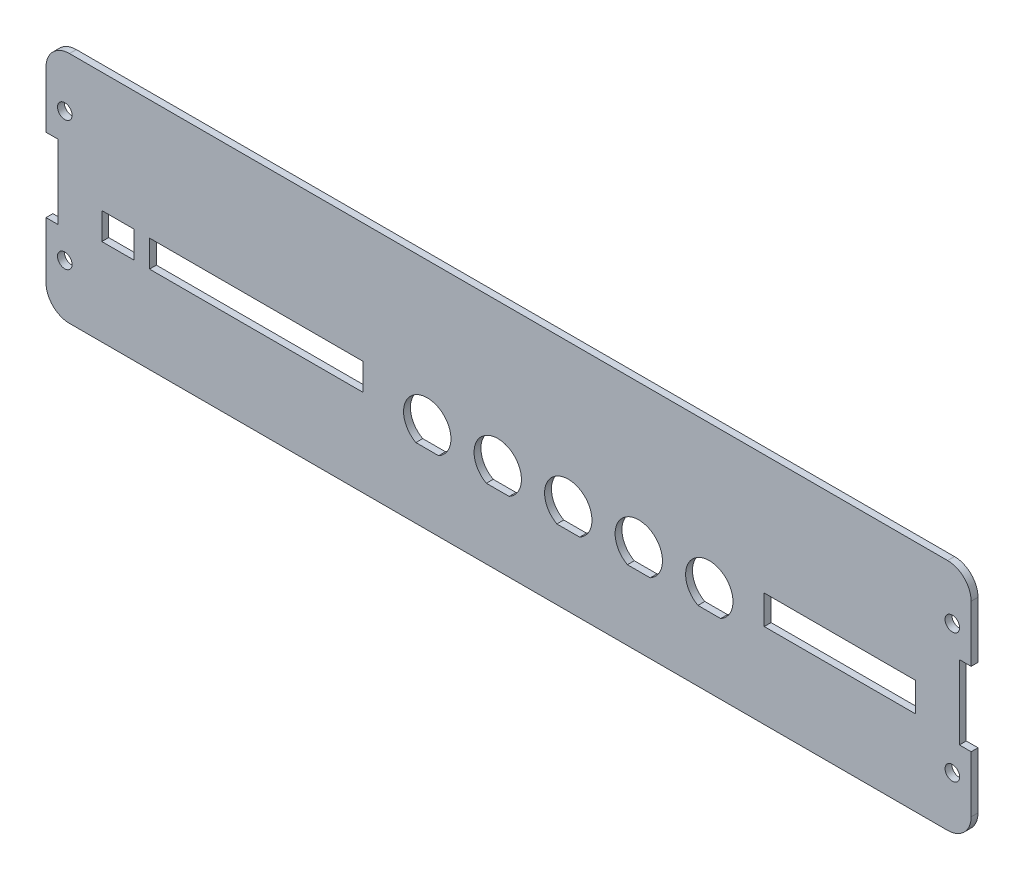
from build123d import *

# Parameters (mm, degrees)
MAINBODY_DEPTH     = 1.8542
SKETCH3_R          = 1.9685
MOUNTHOLES_DEPTH   = 129.907885308
CUT_EXTRUDE1_REACH = 130.908
SKETCH4_W          = 40.934
SKETCH4_H          = 7.854
SKETCH4_W_2        = 57.654
SKETCH4_H_2        = 7.254
SKETCH4_W_3        = 8.654


with BuildPart() as part:
    # Sketch2 → MainBody (new body)
    with BuildSketch(Plane.XY):
        with BuildLine():
            Line((118.618, 31.5722), (-118.618, 31.5722))
            ThreePointArc((-118.618, 31.5722), (-123.108128061, 29.712328061), (-124.968, 25.2222))
            Line((-124.968, 25.2222), (-124.968, 9.9822))
            Line((-124.968, 9.9822), (-121.793, 9.9822))
            Line((-121.793, 9.9822), (-121.793, -9.9822))
            Line((-121.793, -9.9822), (-124.968, -9.9822))
            Line((-124.968, -9.9822), (-124.968, -25.2222))
            ThreePointArc((-124.968, -25.2222), (-123.108128061, -29.712328061), (-118.618, -31.5722))
            Line((-118.618, -31.5722), (118.618, -31.5722))
            ThreePointArc((118.618, -31.5722), (123.108128061, -29.712328061), (124.968, -25.2222))
            Line((124.968, -25.2222), (124.968, -9.9822))
            Line((124.968, -9.9822), (121.793, -9.9822))
            Line((121.793, -9.9822), (121.793, 9.9822))
            Line((121.793, 9.9822), (124.968, 9.9822))
            Line((124.968, 9.9822), (124.968, 25.2222))
            ThreePointArc((124.968, 25.2222), (123.108128061, 29.712328061), (118.618, 31.5722))
        make_face()
    extrude(amount=MAINBODY_DEPTH)

    # Sketch3 → MountHoles (cut, through all)
    with BuildSketch(Plane.XY.offset(1.8542)):
        with Locations((-119.888, 17.4625)):
            Circle(SKETCH3_R)
        with Locations((119.888, 17.4625)):
            Circle(SKETCH3_R)
        with Locations((119.888, -17.4625)):
            Circle(SKETCH3_R)
        with Locations((-119.888, -17.4625)):
            Circle(SKETCH3_R)
    extrude(amount=-MOUNTHOLES_DEPTH, mode=Mode.SUBTRACT)

    # Sketch4 → Cut-Extrude1 (cut, up to next)
    with BuildSketch(Plane.XY.offset(1.8542), mode=Mode.PRIVATE) as cut_extrude1_sk1:
        with BuildLine():
            Line((51.153291776, -12.65754977), (57.304708224, -12.65754977))
            ThreePointArc((57.304708224, -12.65754977), (54.229, -0.64334977), (51.153291776, -12.65754977))
        make_face()
    cut_extrude1_tool1 = extrude(cut_extrude1_sk1.sketch, amount=-CUT_EXTRUDE1_REACH, mode=Mode.PRIVATE) & part.part
    # Sketch4 → Cut-Extrude1 (cut, up to next)
    with BuildSketch(Plane.XY.offset(1.8542), mode=Mode.PRIVATE) as cut_extrude1_sk2:
        with Locations((89.535, -4.72055)):
            Rectangle(SKETCH4_W, SKETCH4_H)
    cut_extrude1_tool2 = extrude(cut_extrude1_sk2.sketch, amount=-CUT_EXTRUDE1_REACH, mode=Mode.PRIVATE) & part.part
    # Sketch4 → Cut-Extrude1 (cut, up to next)
    with BuildSketch(Plane.XY.offset(1.8542), mode=Mode.PRIVATE) as cut_extrude1_sk3:
        with BuildLine():
            Line((32.103291776, -12.65754977), (38.254708224, -12.65754977))
            ThreePointArc((38.254708224, -12.65754977), (35.179, -0.64334977), (32.103291776, -12.65754977))
        make_face()
    cut_extrude1_tool3 = extrude(cut_extrude1_sk3.sketch, amount=-CUT_EXTRUDE1_REACH, mode=Mode.PRIVATE) & part.part
    # Sketch4 → Cut-Extrude1 (cut, up to next)
    with BuildSketch(Plane.XY.offset(1.8542), mode=Mode.PRIVATE) as cut_extrude1_sk4:
        with BuildLine():
            Line((13.053291776, -12.65754977), (19.204708224, -12.65754977))
            ThreePointArc((19.204708224, -12.65754977), (16.129, -0.64334977), (13.053291776, -12.65754977))
        make_face()
    cut_extrude1_tool4 = extrude(cut_extrude1_sk4.sketch, amount=-CUT_EXTRUDE1_REACH, mode=Mode.PRIVATE) & part.part
    # Sketch4 → Cut-Extrude1 (cut, up to next)
    with BuildSketch(Plane.XY.offset(1.8542), mode=Mode.PRIVATE) as cut_extrude1_sk5:
        with BuildLine():
            Line((-5.996708224, -12.65754977), (0.154708224, -12.65754977))
            ThreePointArc((0.154708224, -12.65754977), (-2.921, -0.64334977), (-5.996708224, -12.65754977))
        make_face()
    cut_extrude1_tool5 = extrude(cut_extrude1_sk5.sketch, amount=-CUT_EXTRUDE1_REACH, mode=Mode.PRIVATE) & part.part
    # Sketch4 → Cut-Extrude1 (cut, up to next)
    with BuildSketch(Plane.XY.offset(1.8542), mode=Mode.PRIVATE) as cut_extrude1_sk6:
        with BuildLine():
            Line((-25.046708224, -12.65754977), (-18.895291776, -12.65754977))
            ThreePointArc((-18.895291776, -12.65754977), (-21.971, -0.64334977), (-25.046708224, -12.65754977))
        make_face()
    cut_extrude1_tool6 = extrude(cut_extrude1_sk6.sketch, amount=-CUT_EXTRUDE1_REACH, mode=Mode.PRIVATE) & part.part
    # Sketch4 → Cut-Extrude1 (cut, up to next)
    with BuildSketch(Plane.XY.offset(1.8542), mode=Mode.PRIVATE) as cut_extrude1_sk7:
        with Locations((-68.171, -4.42055)):
            Rectangle(SKETCH4_W_2, SKETCH4_H_2)
    cut_extrude1_tool7 = extrude(cut_extrude1_sk7.sketch, amount=-CUT_EXTRUDE1_REACH, mode=Mode.PRIVATE) & part.part
    # Sketch4 → Cut-Extrude1 (cut, up to next)
    with BuildSketch(Plane.XY.offset(1.8542), mode=Mode.PRIVATE) as cut_extrude1_sk8:
        with Locations((-105.5650001, -4.42055)):
            Rectangle(SKETCH4_W_3, SKETCH4_H_2)
    cut_extrude1_tool8 = extrude(cut_extrude1_sk8.sketch, amount=-CUT_EXTRUDE1_REACH, mode=Mode.PRIVATE) & part.part
    add(cut_extrude1_tool1.solids().sort_by_distance((54.229, -6.889516, 1.8542))[0], mode=Mode.SUBTRACT)
    add(cut_extrude1_tool2.solids().sort_by_distance((89.535, -4.72055, 1.8542))[0], mode=Mode.SUBTRACT)
    add(cut_extrude1_tool3.solids().sort_by_distance((35.179, -6.889516, 1.8542))[0], mode=Mode.SUBTRACT)
    add(cut_extrude1_tool4.solids().sort_by_distance((16.129, -6.889516, 1.8542))[0], mode=Mode.SUBTRACT)
    add(cut_extrude1_tool5.solids().sort_by_distance((-2.921, -6.889516, 1.8542))[0], mode=Mode.SUBTRACT)
    add(cut_extrude1_tool6.solids().sort_by_distance((-21.971, -6.889516, 1.8542))[0], mode=Mode.SUBTRACT)
    add(cut_extrude1_tool7.solids().sort_by_distance((-68.171, -4.42055, 1.8542))[0], mode=Mode.SUBTRACT)
    add(cut_extrude1_tool8.solids().sort_by_distance((-105.565, -4.42055, 1.8542))[0], mode=Mode.SUBTRACT)


solid = part.part
